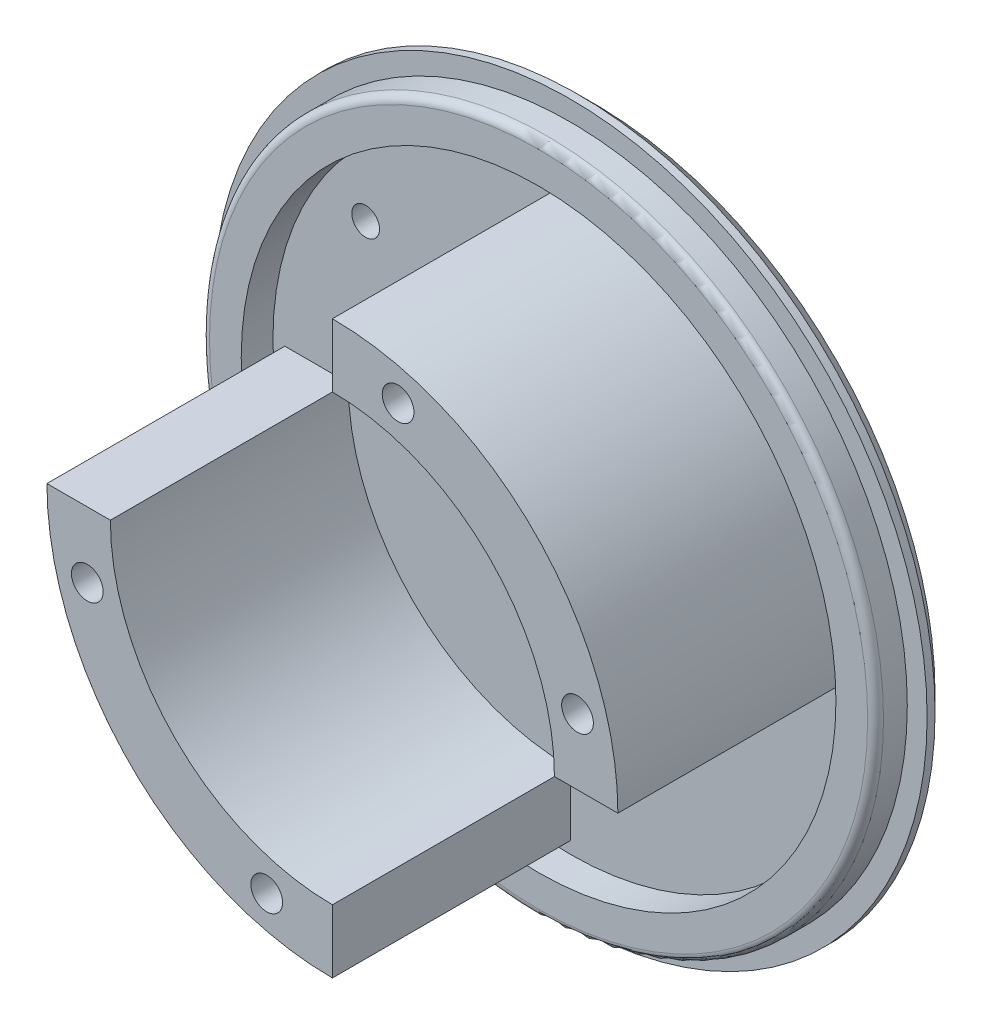
from build123d import *

# Parameters (mm, degrees)
SKETCH1_R           = 45
BOSS_EXTRUDE1_DEPTH = 3
SKETCH2_R           = 42.5
SKETCH2_R_2         = 37.5
BOSS_EXTRUDE2_DEPTH = 4
CHAMFER1_SIZE       = 2
FILLET1_R           = 1
BOSS_EXTRUDE3_DEPTH = 30
SKETCH4_R           = 2
CUT_EXTRUDE1_DEPTH  = 15
CIRPATTERN1_COUNT   = 2
SKETCH5_R           = 1.75
CUT_EXTRUDE2_DEPTH  = 71.356236397


with BuildPart() as part:
    # Sketch1 → Boss-Extrude1 (new body)
    with BuildSketch(Plane.XY):
        Circle(SKETCH1_R)
    extrude(amount=BOSS_EXTRUDE1_DEPTH)

    # Sketch2 → Boss-Extrude2 (add)
    with BuildSketch(Plane.XY.offset(3)):
        Circle(SKETCH2_R)
        Circle(SKETCH2_R_2, mode=Mode.SUBTRACT)
    extrude(amount=BOSS_EXTRUDE2_DEPTH)

    # Chamfer1
    chamfer1_edges = [part.edges().sort_by_distance(p)[0] for p in [
        (-45, 0, 0),
    ]]
    chamfer(chamfer1_edges, length=CHAMFER1_SIZE)

    # Fillet1
    fillet1_edges = [part.edges().sort_by_distance(p)[0] for p in [
        (-42.5, 0, 7),
    ]]
    fillet(fillet1_edges, radius=FILLET1_R)

    # Sketch3 → Boss-Extrude3 (add)
    with BuildSketch(Plane.XY.offset(3)):
        with BuildLine():
            Line((-36, 0), (-28, 0))
            ThreePointArc((-28, 0), (-19.798989873, -19.798989873), (0, -28))
            Line((0, -28), (0, -36))
            ThreePointArc((0, -36), (-25.455844123, -25.455844123), (-36, 0))
        make_face()
    boss_extrude3 = extrude(amount=BOSS_EXTRUDE3_DEPTH)

    # Sketch4 → Cut-Extrude1 (cut)
    with BuildSketch(Plane.XY.offset(33)):
        with Locations((-30.909626441, -8.282209443)):
            Circle(SKETCH4_R)
        with Locations((-8.282209443, -30.909626441)):
            Circle(SKETCH4_R)
    cut_extrude1 = extrude(amount=-CUT_EXTRUDE1_DEPTH, mode=Mode.SUBTRACT)

    # CirPattern1: Boss-Extrude3, Cut-Extrude1 ×2 about axis
    cirpattern1_axis = Axis((0, 0, 3), (0, 0, 1))
    add([boss_extrude3.rotate(cirpattern1_axis, i * 360 / CIRPATTERN1_COUNT) for i in range(1, CIRPATTERN1_COUNT)])
    add([cut_extrude1.rotate(cirpattern1_axis, i * 360 / CIRPATTERN1_COUNT) for i in range(1, CIRPATTERN1_COUNT)], mode=Mode.SUBTRACT)

    # Sketch5 → Cut-Extrude2 (cut, through all)
    with BuildSketch(Plane.XY.offset(3)):
        with Locations((-25.809397513, 18.738329701)):
            Circle(SKETCH5_R)
        with Locations((-13.788582233, 6.717514421)):
            Circle(SKETCH5_R)
    extrude(amount=-CUT_EXTRUDE2_DEPTH, mode=Mode.SUBTRACT)


solid = part.part
